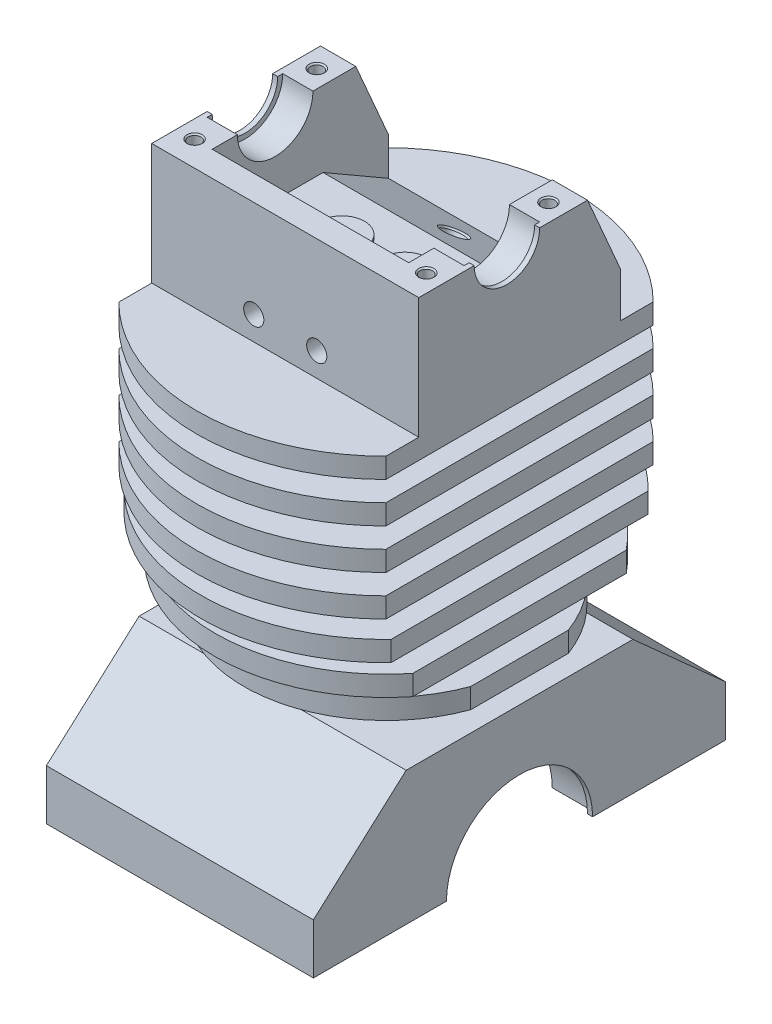
from build123d import *

# Parameters (mm, degrees)
SKICA4_R                    = 4
ODEBRAT_VYSUNUT_M1_DEPTH    = 161.15617378
SKICA5_R                    = 9
SKICA5_R_2                  = 4
P_IDAT_VYSUNUT_M1_DEPTH     = 1.5
SKICA6_W                    = 90
SKICA6_H                    = 10
P_IDAT_VYSUNUT_M3_DEPTH     = 53
ODEBRAT_VYSUNUT_M2_DEPTH    = 35
SKICA7_R                    = 25
ODEBRAT_VYSUNUT_M3_DEPTH    = 173.081696102
SKICA9_W                    = 47
SKICA9_H                    = 81.822124963
ODEBRAT_VYSUNUT_M4_DEPTH    = 216.313980348
M6_Z_VIT1_D                 = 5
M6_Z_VIT1_DEPTH             = 17
M6_Z_VIT1_CSINK_D           = 6.05
M6_Z_VIT1_CSINK_ANGLE       = 90
M6_Z_VIT1_TIP               = 1.502151548
P_IDAT_START                = -53
P_IDAT_VYSUNUT_M4_DEPTH     = 106
SKICA14_W                   = 78
SKICA14_H                   = 70
ODEBRAT_VYSUNUT_M5_DEPTH    = 30
SKICA15_R                   = 4
ODEBRAT_VYSUNUT_M6_DEPTH    = 208.347197072
SKICA16_W                   = 80
SKICA16_H                   = 4
P_IDAT_VYSUNUT_M5_DEPTH     = 1
ZKOSEN_4_SIZE               = 3
ZKOSEN_2_SIZE               = 15
ZKOSEN_2_SIZE2              = 25.980762114
ZKOSEN_3_SIZE               = 3
M10X1_25_Z_VIT1_D           = 8.8
M10X1_25_Z_VIT1_DEPTH       = 26.25
M10X1_25_Z_VIT1_CSINK_D     = 10.05
M10X1_25_Z_VIT1_CSINK_ANGLE = 90
M10X1_25_Z_VIT1_TIP         = 2.643786724
ODEBRAT_VYSUNUT_M7_REACH    = 217.754
SKICA25_R                   = 4
SKICA26_R                   = 9
SKICA26_R_2                 = 2
P_IDAT_VYSUNUT_M6_DEPTH     = 6


# Read off the part's stored shape, not the designer's step: Přidat vysunutím4, M6 závit2
with BuildPart() as part:
    # Skica2 → Rotovat1 (revolve)
    with BuildSketch(Plane.XY, mode=Mode.PRIVATE) as rotovat1_sk:
        Polygon((25, 0), (45, 0), (45, 10), (33, 10), (33, 18), (56.428571429, 18), (56.428571429, 26), (33, 26), (33, 34), (67.857142857, 34), (67.857142857, 42), (33, 42), (33, 50), (73.571428571, 50), (73.571428571, 58), (33, 58), (33, 66), (75, 66), (75, 74), (33, 74), (33, 82), (75, 82), (75, 90), (33, 90), (33, 98), (75, 98), (75, 106), (33, 106), (33, 114), (75, 114), (75, 122), (40, 122), (40, 140), (0, 140), (0, 120), (25, 120), align=None)
    revolve(rotovat1_sk.sketch.rotate(Axis((0, 148.651800879, 0), (0, -1, 0)), 90), axis=Axis((0, 148.651800879, 0), (0, -1, 0)))

    # Skica4 → Odebrat vysunutím1 (cut, through all)
    with BuildSketch(Plane.XZ.offset(-120)):
        with Locations(Location((12.5, 5, 0), (0, 0, 270))):
            Circle(SKICA4_R)
        with Locations(Location((-12.5, 5, 0), (0, 0, 270))):
            Circle(SKICA4_R)
    extrude(amount=-ODEBRAT_VYSUNUT_M1_DEPTH, mode=Mode.SUBTRACT)

    # Skica5 → Přidat vysunutím1 (add, symmetric)
    # profile 1 of 2: a face of its own
    with BuildSketch(Plane(origin=(0, 140, 0), x_dir=(1, 0, 0), z_dir=(0, 1, 0))):
        with Locations(Location((-12.5, -5, 0), (0, 0, 90))):
            Circle(SKICA5_R)
        with Locations(Location((-12.5, -5, 0), (0, 0, 90))):
            Circle(SKICA5_R_2, mode=Mode.SUBTRACT)
    # profile 2 of 2: a face of its own
    with BuildSketch(Plane(origin=(0, 140, 0), x_dir=(1, 0, 0), z_dir=(0, 1, 0))):
        with Locations(Location((12.5, -5, 0), (0, 0, 90))):
            Circle(SKICA5_R)
        with Locations(Location((12.5, -5, 0), (0, 0, 90))):
            Circle(SKICA5_R_2, mode=Mode.SUBTRACT)
    extrude(amount=P_IDAT_VYSUNUT_M1_DEPTH, both=True)

    # Skica6 → Přidat vysunutím3 (add, symmetric)
    with BuildSketch(Plane(origin=(0, 0, 0), x_dir=(0, 0, -1), z_dir=(1, 0, 0))):
        with Locations((0, 5)):
            Rectangle(SKICA6_W, SKICA6_H)
        Polygon((-45, 0), (-45, 10), (-81.822124963, -23), (-81.822124963, -43), (-61.822124963, -43), (-36, 0), align=None)
        Polygon((36, 0), (-36, 0), (-61.822124963, -43), (61.822124963, -43), align=None)
        Polygon((81.822124963, -23), (45, 10), (45, 0), (36, 0), (61.822124963, -43), (81.822124963, -43), align=None)
    extrude(amount=P_IDAT_VYSUNUT_M3_DEPTH, both=True)

    # Skica6<5> → Odebrat vysunutím2 (cut, symmetric)
    with BuildSketch(Plane(origin=(0, 0, 0), x_dir=(0, 0, -1), z_dir=(1, 0, 0))):
        Polygon((36, 0), (-36, 0), (-61.822124963, -43), (61.822124963, -43), align=None)
    extrude(amount=ODEBRAT_VYSUNUT_M2_DEPTH, both=True, mode=Mode.SUBTRACT)

    # Skica7 → Odebrat vysunutím3 (cut, through all)
    with BuildSketch(Plane(origin=(0, 10, 0), x_dir=(1, 0, 0), z_dir=(0, 1, 0))):
        with Locations(Location((0, 0, 0), (0, 0, 270))):
            Circle(SKICA7_R)
    extrude(amount=-ODEBRAT_VYSUNUT_M3_DEPTH, mode=Mode.SUBTRACT)

    # Skica8 → Odebrat rotací1 (revolve, cut)
    with BuildSketch(Plane.XZ.offset(43)):
        Polygon((-73, 0), (-73, 29), (-51, 29), (-51, 31), (51, 31), (51, 29), (73, 29), (73, 0), align=None)
    revolve(axis=Axis((-111.075378668, -43, 0), (1, 0, 0)), mode=Mode.SUBTRACT)

    # Skica9 → Odebrat vysunutím4 (cut, through all)
    with BuildSketch(Plane.XZ.offset(43)):
        Polygon((-100, 81.822124963), (-100, 0), (-53, 0), (-53, 29), (-53, 81.822124963), align=None)
        with Locations((-76.5, -40.911062482)):
            Rectangle(SKICA9_W, SKICA9_H)
        with Locations((76.5, -40.911062482)):
            Rectangle(SKICA9_W, SKICA9_H)
        Polygon((53, 29), (53, 0), (100, 0), (100, 81.822124963), (53, 81.822124963), align=None)
    extrude(amount=-ODEBRAT_VYSUNUT_M4_DEPTH, mode=Mode.SUBTRACT)

    # M6 závit1
    with Locations(Plane(origin=(0, -43, 0), x_dir=(-1, 0, 0), z_dir=(0, -1, 0))):
        with Locations((-47, 46.822124963), (-25, 75.822124963), (25, -75.822124963), (47, -46.822124963), (25, 75.822124963), (-25, -75.822124963), (-47, -46.822124963), (47, 46.822124963)):
            CounterSinkHole(M6_Z_VIT1_D / 2, M6_Z_VIT1_CSINK_D / 2, depth=M6_Z_VIT1_DEPTH, counter_sink_angle=M6_Z_VIT1_CSINK_ANGLE)
            with Locations((0, 0, -(M6_Z_VIT1_DEPTH + M6_Z_VIT1_TIP / 2))):  # 118° drill point
                Cone(0, M6_Z_VIT1_D / 2, M6_Z_VIT1_TIP, mode=Mode.SUBTRACT)



with BuildPart() as body_2:
    # Přidat vysunutím4 outline → Přidat vysunutím4 (new body)
    with BuildSketch(Plane(origin=(0, 0, 0), x_dir=(0, 0, -1), z_dir=(1, 0, 0)).offset(P_IDAT_START)):
        Polygon((40, 140), (27, 170), (-40, 170), (-40, 122), (40, 122), align=None)
    extrude(amount=P_IDAT_VYSUNUT_M4_DEPTH)

    # Skica14 → Odebrat vysunutím5 (cut)
    with BuildSketch(Plane(origin=(0, 170, 0), x_dir=(1, 0, 0), z_dir=(0, 1, 0))):
        with Locations((0, 5)):
            Rectangle(SKICA14_W, SKICA14_H)
    extrude(amount=-ODEBRAT_VYSUNUT_M5_DEPTH, mode=Mode.SUBTRACT)

    # Skica15 → Odebrat vysunutím6 (cut, through all)
    with BuildSketch(Plane(origin=(0, 140, 0), x_dir=(1, 0, 0), z_dir=(0, 1, 0))):
        with Locations(Location((12.5, -5, 0), (0, 0, 90))):
            Circle(SKICA15_R)
        with Locations(Location((-12.5, -5, 0), (0, 0, 90))):
            Circle(SKICA15_R)
    extrude(amount=-ODEBRAT_VYSUNUT_M6_DEPTH, mode=Mode.SUBTRACT)


with BuildPart() as part_1:
    add(part.part)

    add(body_2.part)  # Přidat vysunutím5 merges body 2
    # Skica16 → Přidat vysunutím5 (add)
    with BuildSketch(Plane(origin=(53, 0, 0), x_dir=(0, 0, -1), z_dir=(1, 0, 0))):
        with Locations((0, 122)):
            Rectangle(SKICA16_W, SKICA16_H)
    extrude(amount=-P_IDAT_VYSUNUT_M5_DEPTH)

    # Zkosení4
    zkosen_4_edges = [part_1.edges().sort_by_distance(p)[0] for p in [
        (-12.5, 120, 9),
        (12.5, 120, 9),
    ]]
    chamfer(zkosen_4_edges, length=ZKOSEN_4_SIZE)

    # Skica17 → Odebrat rotací2 (revolve, cut)
    with BuildSketch(Plane(origin=(0, 0, 5), x_dir=(0, -1, 0), z_dir=(0, 0, 1))):
        Polygon((-170, 58), (-157, 58), (-157, 51), (-155, 51), (-155, -51), (-157, -51), (-157, -58), (-170, -58), align=None)
    revolve(axis=Axis((88.270190347, 170, 5), (-1, 0, 0)), mode=Mode.SUBTRACT)

    # M6 závit2 outline → M6 závit2 (revolve, cut)
    with BuildSketch(Plane(origin=(46, 0, -18.5), x_dir=(1, 0, 0), z_dir=(0, 0, 1))):
        Polygon((0, 170), (0, 151.497848452), (2.5, 153), (2.5, 169.475), (3.025, 170), align=None)
    revolve(axis=Axis((46, 0, -18.5), (0, 1, 0)), mode=Mode.SUBTRACT)

    # M6 z_vit2 2 outline → M6 z_vit2 2 (revolve, cut)
    with BuildSketch(Plane(origin=(-46, 0, 30), x_dir=(1, 0, 0), z_dir=(0, 0, 1))):
        Polygon((0, 170), (0, 151.497848452), (2.5, 153), (2.5, 169.475), (3.025, 170), align=None)
    revolve(axis=Axis((-46, 0, 30), (0, 1, 0)), mode=Mode.SUBTRACT)

    # M6 z_vit2 3 outline → M6 z_vit2 3 (revolve, cut)
    with BuildSketch(Plane(origin=(46, 0, 30), x_dir=(1, 0, 0), z_dir=(0, 0, 1))):
        Polygon((0, 170), (0, 151.497848452), (2.5, 153), (2.5, 169.475), (3.025, 170), align=None)
    revolve(axis=Axis((46, 0, 30), (0, 1, 0)), mode=Mode.SUBTRACT)

    # M6 z_vit2 4 outline → M6 z_vit2 4 (revolve, cut)
    with BuildSketch(Plane(origin=(-46, 0, -18.5), x_dir=(1, 0, 0), z_dir=(0, 0, 1))):
        Polygon((0, 170), (0, 151.497848452), (2.5, 153), (2.5, 169.475), (3.025, 170), align=None)
    revolve(axis=Axis((-46, 0, -18.5), (0, 1, 0)), mode=Mode.SUBTRACT)

    # Zkosení2
    zkosen_2_edges = [part_1.edges().sort_by_distance(p)[0] for p in [
        (0, 140, -40),
    ]]
    zkosen_2_side = [part_1.faces().sort_by_distance(p)[0] for p in [
        (0, 131, -40),
    ]]
    chamfer(zkosen_2_edges, length=ZKOSEN_2_SIZE, length2=ZKOSEN_2_SIZE2, reference=zkosen_2_side[0])

    # Zkosení3
    zkosen_3_edges = [part_1.edges().sort_by_distance(p)[0] for p in [
        (0, 120, -25),
    ]]
    chamfer(zkosen_3_edges, length=ZKOSEN_3_SIZE)

    # M10x1.25 závit1
    with Locations(Plane(origin=(0, 111.070508076, -64.126587737), x_dir=(1, 0, 0), z_dir=(0, 0.8660254037844383, -0.5000000000000007))):
        with Locations((0, -42.858983849)):
            CounterSinkHole(M10X1_25_Z_VIT1_D / 2, M10X1_25_Z_VIT1_CSINK_D / 2, depth=M10X1_25_Z_VIT1_DEPTH, counter_sink_angle=M10X1_25_Z_VIT1_CSINK_ANGLE)
            with Locations((0, 0, -(M10X1_25_Z_VIT1_DEPTH + M10X1_25_Z_VIT1_TIP / 2))):  # 118° drill point
                Cone(0, M10X1_25_Z_VIT1_D / 2, M10X1_25_Z_VIT1_TIP, mode=Mode.SUBTRACT)

    # Skica25 → Odebrat vysunutím7 (cut, up to next)
    with BuildSketch(Plane.XY.offset(40), mode=Mode.PRIVATE) as odebrat_vysunut_m7_sk1:
        with Locations((-12.5, 131.5)):
            Circle(SKICA25_R)
    odebrat_vysunut_m7_tool1 = extrude(odebrat_vysunut_m7_sk1.sketch, amount=-ODEBRAT_VYSUNUT_M7_REACH, mode=Mode.PRIVATE) & part_1.part
    # Skica25 → Odebrat vysunutím7 (cut, up to next)
    with BuildSketch(Plane.XY.offset(40), mode=Mode.PRIVATE) as odebrat_vysunut_m7_sk2:
        with Locations((12.5, 131.5)):
            Circle(SKICA25_R)
    odebrat_vysunut_m7_tool2 = extrude(odebrat_vysunut_m7_sk2.sketch, amount=-ODEBRAT_VYSUNUT_M7_REACH, mode=Mode.PRIVATE) & part_1.part
    add(odebrat_vysunut_m7_tool1.solids().sort_by_distance((-12.5, 131.5, 40))[0], mode=Mode.SUBTRACT)
    add(odebrat_vysunut_m7_tool2.solids().sort_by_distance((12.5, 131.5, 40))[0], mode=Mode.SUBTRACT)

    # Skica26 → Přidat vysunutím6 (add)
    # profile 1 of 2: a face of its own
    with BuildSketch(Plane(origin=(0, 141.5, 0), x_dir=(1, 0, 0), z_dir=(0, 1, 0))):
        with Locations(Location((-12.5, -5, 0), (0, 0, 90))):
            Circle(SKICA26_R)
        with Locations(Location((-12.5, -5, 0), (0, 0, 270))):
            Circle(SKICA26_R_2, mode=Mode.SUBTRACT)
    # profile 2 of 2: a face of its own
    with BuildSketch(Plane(origin=(0, 141.5, 0), x_dir=(1, 0, 0), z_dir=(0, 1, 0))):
        with Locations(Location((12.5, -5, 0), (0, 0, 90))):
            Circle(SKICA26_R)
        with Locations(Location((12.5, -5, 0), (0, 0, 270))):
            Circle(SKICA26_R_2, mode=Mode.SUBTRACT)
    extrude(amount=-P_IDAT_VYSUNUT_M6_DEPTH)


solid = part_1.part
